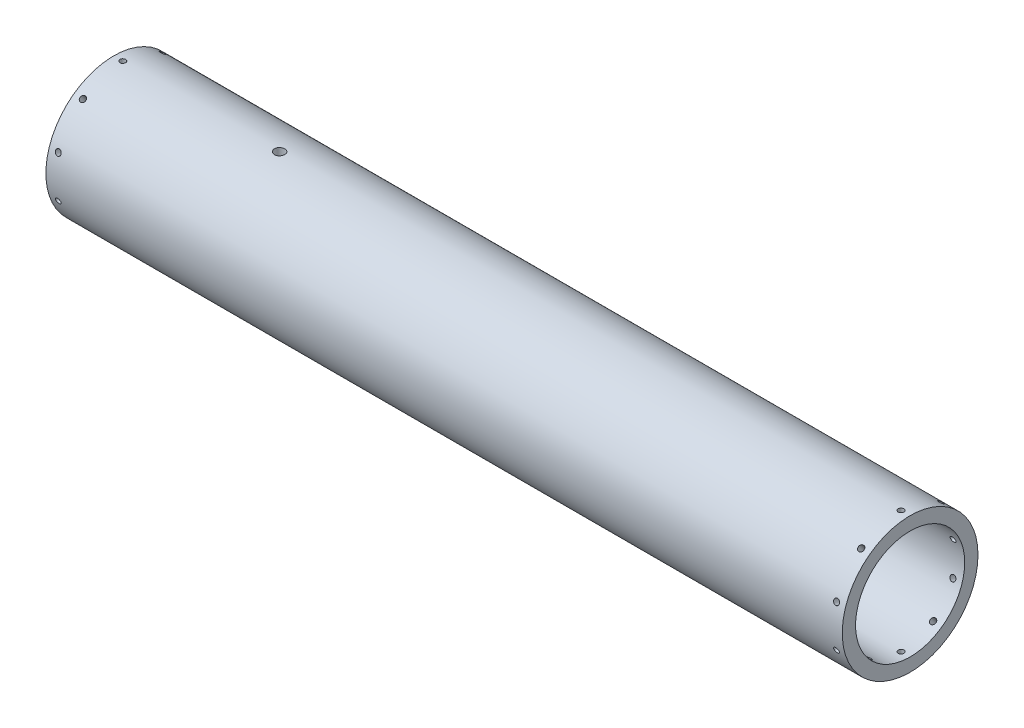
from build123d import *

# Parameters (mm, degrees)
SKETCH1_R           = 57.15
SKETCH1_R_2         = 45.9486
BOSS_EXTRUDE1_DEPTH = 670.56
SKETCH6_R           = 2.413
CUT_EXTRUDE1_DEPTH  = 15.24
SKETCH7_R           = 2.413
CUT_EXTRUDE2_DEPTH  = 15.24
CIRPATTERN2_COUNT   = 10
CIRPATTERN3_COUNT   = 10
SKETCH8_R           = 4.3053
CUT_EXTRUDE3_DEPTH  = 683.628248953


with BuildPart() as part:
    # Sketch1 → Boss-Extrude1 (new body)
    with BuildSketch(Plane(origin=(0, 0, 0), x_dir=(0, 0, -1), z_dir=(1, 0, 0))):
        Circle(SKETCH1_R)
        Circle(SKETCH1_R_2, mode=Mode.SUBTRACT)
    extrude(amount=BOSS_EXTRUDE1_DEPTH)

    # Sketch6 → Cut-Extrude1 (cut)
    with BuildSketch(Plane(origin=(0, 57.15, 0), x_dir=(1, 0, 0), z_dir=(0, 1, 0))):
        with Locations((7.62, 0)):
            Circle(SKETCH6_R)
    cut_extrude1 = extrude(amount=-CUT_EXTRUDE1_DEPTH, mode=Mode.SUBTRACT)

    # Sketch7 → Cut-Extrude2 (cut)
    with BuildSketch(Plane(origin=(0, 57.15, 0), x_dir=(1, 0, 0), z_dir=(0, 1, 0))):
        with Locations((662.94, 0)):
            Circle(SKETCH7_R)
    cut_extrude2 = extrude(amount=-CUT_EXTRUDE2_DEPTH, mode=Mode.SUBTRACT)

    # CirPattern2: Cut-Extrude2 ×10 about axis
    cirpattern2_axis = Axis((670.56, 0, 0), (1, 0, 0))
    for i in range(1, CIRPATTERN2_COUNT):
        add(cut_extrude2.rotate(cirpattern2_axis, i * 360 / CIRPATTERN2_COUNT), mode=Mode.SUBTRACT)

    # CirPattern3: Cut-Extrude1 ×10 about axis
    cirpattern3_axis = Axis((0, 0, 0), (-1, 0, 0))
    for i in range(1, CIRPATTERN3_COUNT):
        add(cut_extrude1.rotate(cirpattern3_axis, i * 360 / CIRPATTERN3_COUNT), mode=Mode.SUBTRACT)

    # Sketch8 → Cut-Extrude3 (cut, through all)
    with BuildSketch(Plane(origin=(0, 57.15, 0), x_dir=(1, 0, 0), z_dir=(0, 1, 0))):
        with Locations((139.7, 0)):
            Circle(SKETCH8_R)
    extrude(amount=-CUT_EXTRUDE3_DEPTH, mode=Mode.SUBTRACT)


solid = part.part
